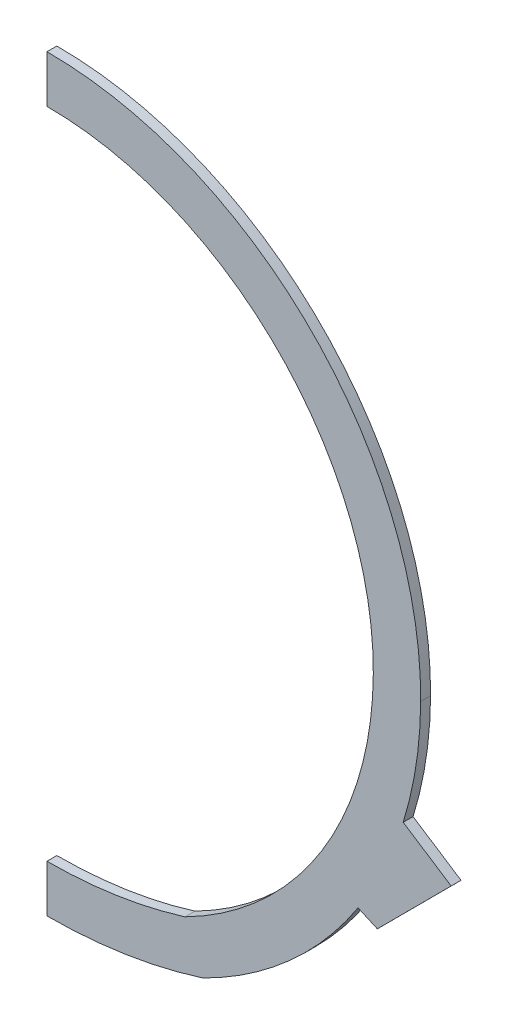
from build123d import *

# Parameters (mm, degrees)
BOSS_EXTRUDE1_DEPTH = 1.5875
SKETCH3_W           = 208.645691316
SKETCH3_H           = 383.026987577
CUT_EXTRUDE1_DEPTH  = 184.927178997
BOSS_EXTRUDE2_DEPTH = 1.5875


with BuildPart() as part:
    # Sketch2 → Boss-Extrude1 (new, symmetric)
    with BuildSketch(Plane.XY):
        with BuildLine():
            ThreePointArc((-120.098895727, 19.05), (0.406748907, 139.2017743), (120.203613722, 18.343301545))
            ThreePointArc((120.203613722, 18.343301545), (101.067699546, -47.629728931), (50.138751442, -93.726))
            ThreePointArc((50.138751442, -93.726), (0.040174098, -101.514794876), (-50.058403246, -93.726))
            ThreePointArc((-50.058403246, -93.726), (-101.163912713, -47.327889321), (-120.098895727, 19.05))
        make_face()
        with BuildLine():
            ThreePointArc((-104.858895727, 19.05), (0.361930242, 123.961840203), (104.963877332, 18.432938489))
            ThreePointArc((104.963877332, 18.432938489), (88.446745877, -39.065849025), (44.40486057, -79.553359885))
            ThreePointArc((44.40486057, -79.553359885), (0.040463589, -86.274794876), (-44.323959374, -79.553531384))
            ThreePointArc((-44.323959374, -79.553531384), (-88.517658334, -38.801393502), (-104.858895727, 19.05))
        make_face(mode=Mode.SUBTRACT)
    extrude(amount=BOSS_EXTRUDE1_DEPTH, both=True)

    # Sketch3 → Cut-Extrude1 (cut, through all)
    with BuildSketch(Plane(origin=(0, 0, 0), x_dir=(0, 0, -1), z_dir=(1, 0, 0))):
        with Locations((4.266053154, 20.866300598)):
            Rectangle(SKETCH3_W, SKETCH3_H)
    extrude(amount=-CUT_EXTRUDE1_DEPTH, mode=Mode.SUBTRACT)

    # Sketch5 → Boss-Extrude2 (add, symmetric)
    with BuildSketch(Plane.XY):
        Polygon((106.258152496, -51.988683319), (130.011728615, -28.168431361), (114.573822099, -18.142937646), (100.046993583, -49.235229101), align=None)
    extrude(amount=BOSS_EXTRUDE2_DEPTH, both=True)


solid = part.part
